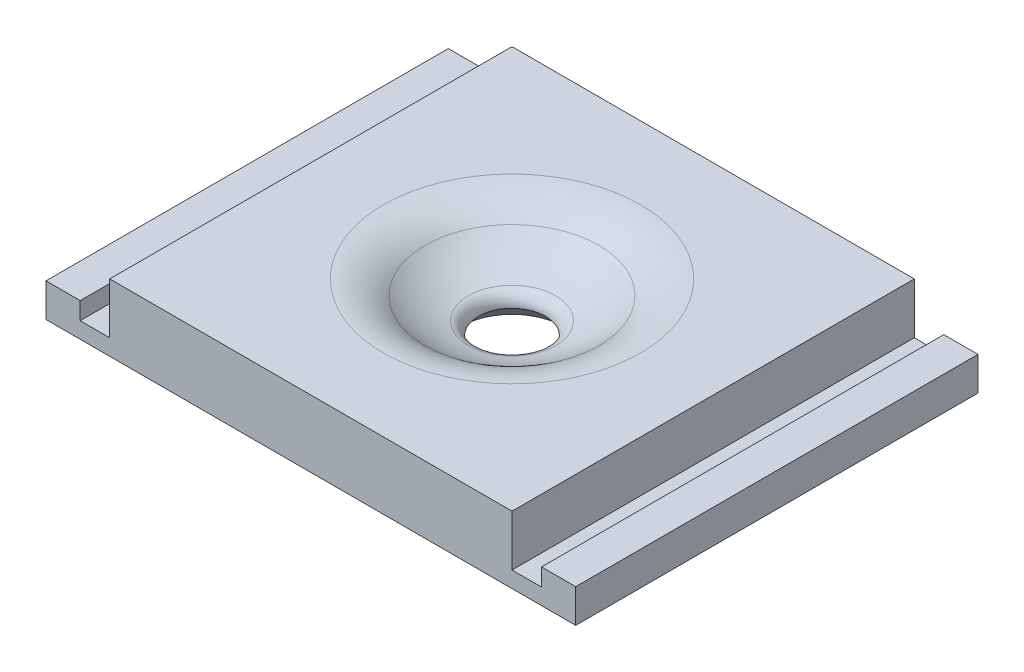
from build123d import *

# Parameters (mm, degrees)
SKETCH1_W               = 30
SKETCH1_H               = 30
MAIN_BODY_DEPTH         = 11
SKETCH2_W               = 17.84
SKETCH2_H               = 2.8
WIRE_HOLE_DEPTH         = 6
BOARD_CAVITY_DEPTH      = 3
BOARD_CAVITY_DEPTH_BACK = 17.2
SKETCH3_W               = 20.5
SKETCH3_H               = 3.6
SKETCH4_W               = 10
SKETCH4_H               = 10
LIGHT_BOX_DEPTH         = 2
SKETCH5_R               = 2.5
CUT_EXTRUDE4_DEPTH      = 5
SKETCH7_W               = 20.5
SKETCH7_H               = 3.6
CUT_EXTRUDE5_DEPTH      = 1
BOSS_EXTRUDE1_DEPTH     = 30
BOSS_EXTRUDE2_START     = 2
SKETCH11_W              = 10
SKETCH11_H              = 10
SKETCH11_R              = 2.5
BOSS_EXTRUDE2_DEPTH     = 2
SKETCH12_W              = 44.564275197
SKETCH12_H              = 6
CUT_EXTRUDE6_DEPTH      = 40
FILLET1_R               = 5
FILLET2_R               = 1


with BuildPart() as part:
    # Sketch1 → Main Body (new body)
    with BuildSketch(Plane(origin=(0, 0, 0), x_dir=(1, 0, 0), z_dir=(0, 1, 0))):
        Rectangle(SKETCH1_W, SKETCH1_H)
    extrude(amount=MAIN_BODY_DEPTH)

    # Sketch2 → Wire Hole (cut)
    with BuildSketch(Plane.XZ):
        with Locations((0, 8.6)):
            Rectangle(SKETCH2_W, SKETCH2_H)
    extrude(amount=-WIRE_HOLE_DEPTH, mode=Mode.SUBTRACT)

    # Sketch3 → Board Cavity (cut, two sides: drawn at the far end of the back side and taken through both)
    with BuildSketch(Plane.XY.offset(7.2).offset(-BOARD_CAVITY_DEPTH_BACK)):
        with Locations((0, 4.2)):
            Rectangle(SKETCH3_W, SKETCH3_H)
    extrude(amount=BOARD_CAVITY_DEPTH + BOARD_CAVITY_DEPTH_BACK, mode=Mode.SUBTRACT)

    # Sketch4 → Light Box (cut)
    with BuildSketch(Plane.XZ.offset(-6)):
        with Locations((0, 0.05)):
            Rectangle(SKETCH4_W, SKETCH4_H)
    extrude(amount=-LIGHT_BOX_DEPTH, mode=Mode.SUBTRACT)

    # Sketch5 → Cut-Extrude4 (cut)
    with BuildSketch(Plane.XZ.offset(-8)):
        Circle(SKETCH5_R)
    extrude(amount=-CUT_EXTRUDE4_DEPTH, mode=Mode.SUBTRACT)

    # Sketch7 → Cut-Extrude5 (cut)
    with BuildSketch(Plane.XY.offset(-10)):
        with Locations((0, 4.2)):
            Rectangle(SKETCH7_W, SKETCH7_H)
    extrude(amount=-CUT_EXTRUDE5_DEPTH, mode=Mode.SUBTRACT)

    # Sketch8 → Boss-Extrude1 (add)
    with BuildSketch(Plane(origin=(0, 0, -15), x_dir=(-1, 0, 0), z_dir=(0, 0, -1))):
        Polygon((-15, 5.5), (-15, 3.8), (-17.2, 3.8), (-17.2, 2.5), (-19.75, 2.5), (-19.75, 8.5), (-17.2, 8.5), (-17.2, 7.2), (-15, 7.2), align=None)
    boss_extrude1 = extrude(amount=-BOSS_EXTRUDE1_DEPTH)

    # Mirror1: Boss-Extrude1 across plane
    add(boss_extrude1.mirror(Plane(origin=(0, 0, 0), x_dir=(0, 0, 1), z_dir=(1, 0, 0))))

    # Sketch9 → Cut-Revolve6 (revolve, cut)
    with BuildSketch(Plane.XY):
        with BuildLine():
            Line((-0.715, 25.989433281), (-0.715, 8))
            Line((-0.715, 8), (-1.3, 8))
            ThreePointArc((-1.3, 8), (-9.90524506, 17.284063213), (-0.715, 25.989433281))
        make_face()
    revolve(axis=Axis((0, 0, 0), (0, -1, 0)), mode=Mode.SUBTRACT)

    # Sketch11 → Boss-Extrude2 (add)
    with BuildSketch(Plane.XZ.offset(-8).offset(BOSS_EXTRUDE2_START)):
        with Locations((0, 0.05)):
            Rectangle(SKETCH11_W, SKETCH11_H)
        Circle(SKETCH11_R, mode=Mode.SUBTRACT)
    extrude(amount=-BOSS_EXTRUDE2_DEPTH)

    # Sketch12 → Cut-Extrude6 (cut)
    with BuildSketch(Plane(origin=(0, 0, -15), x_dir=(-1, 0, 0), z_dir=(0, 0, -1))):
        with Locations((-0.667629591, 3)):
            Rectangle(SKETCH12_W, SKETCH12_H)
    extrude(amount=-CUT_EXTRUDE6_DEPTH, mode=Mode.SUBTRACT)

    # Fillet1
    fillet1_edges = [part.edges().sort_by_distance(p)[0] for p in [
        (7.625755817, 11, -5e-09),
    ]]
    fillet(fillet1_edges, radius=FILLET1_R)

    # Fillet2
    fillet2_edges = [part.edges().sort_by_distance(p)[0] for p in [
        (0, 8.133109373, 2.499999983),
    ]]
    fillet(fillet2_edges, radius=FILLET2_R)

    # Sketch13 → Cut-Revolve7 (revolve, cut)
    with BuildSketch(Plane.XY):
        Polygon((-2.5, 7.332772815), (-3.832772815, 6), (0, 6), (0, 7.332772815), align=None)
    revolve(axis=Axis((0, 0, 0), (0, -1, 0)), mode=Mode.SUBTRACT)


solid = part.part
